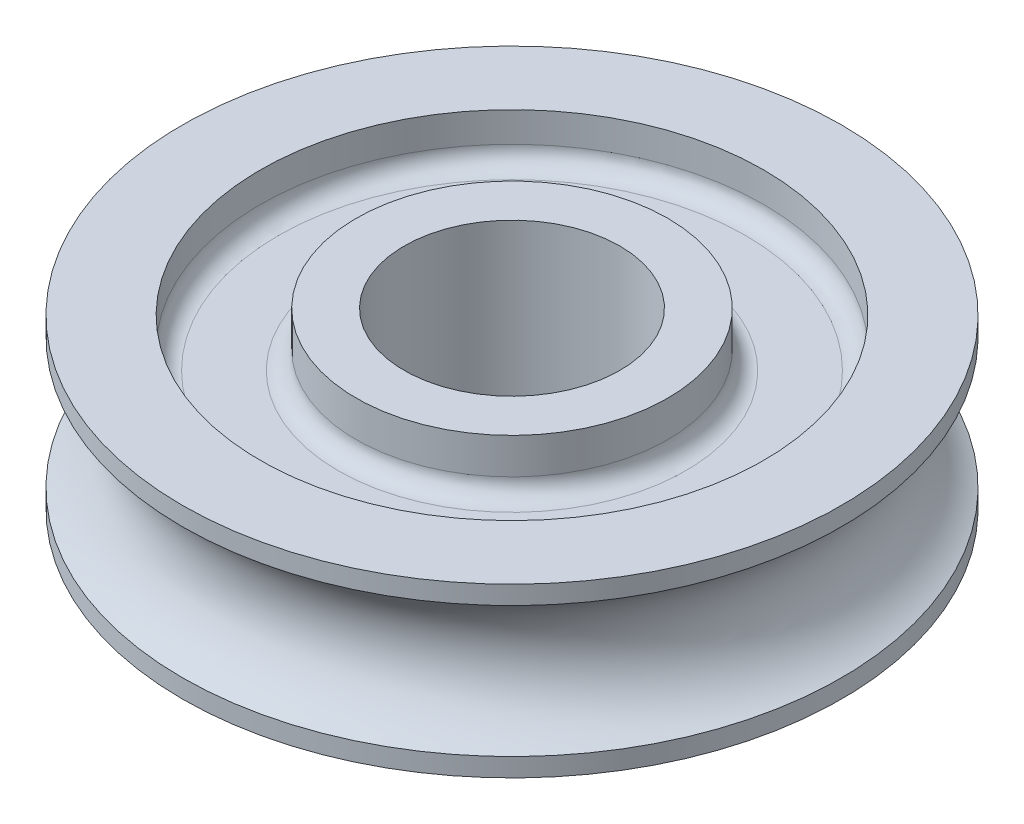
from build123d import *


with BuildPart() as part:
    # Esquisse10 → Révolution2 (revolve)
    with BuildSketch(Plane.XY):
        with BuildLine():
            Line((-18.00000266, -15), (-26.00000266, -15))
            Line((-26.00000266, -15), (-26.00000266, -9))
            ThreePointArc((-26.00000266, -9), (-26.878682316, -6.878679656), (-29.00000266, -6))
            Line((-29.00000266, -6), (-39.00000266, -6))
            ThreePointArc((-39.00000266, -6), (-41.121323004, -6.878679656), (-42.00000266, -9))
            Line((-42.00000266, -9), (-42.00000266, -14))
            Line((-42.00000266, -14), (-55, -14))
            Line((-55, -14), (-55, -10.908712115))
            ThreePointArc((-55, -10.908712115), (-48, 0), (-55, 10.908712115))
            Line((-55, 10.908712115), (-55, 14))
            Line((-55, 14), (-42.00000266, 14))
            Line((-42.00000266, 14), (-42.00000266, 9))
            ThreePointArc((-42.00000266, 9), (-41.121323004, 6.878679656), (-39.00000266, 6))
            Line((-39.00000266, 6), (-29.00000266, 6))
            ThreePointArc((-29.00000266, 6), (-26.878682316, 6.878679656), (-26.00000266, 9))
            Line((-26.00000266, 9), (-26.00000266, 15))
            Line((-26.00000266, 15), (-18.00000266, 15))
            Line((-18.00000266, 15), (-18.00000266, -15))
        make_face()
    revolve(axis=Axis((0, -31.903342088, 0), (0, 1, 0)))


solid = part.part
